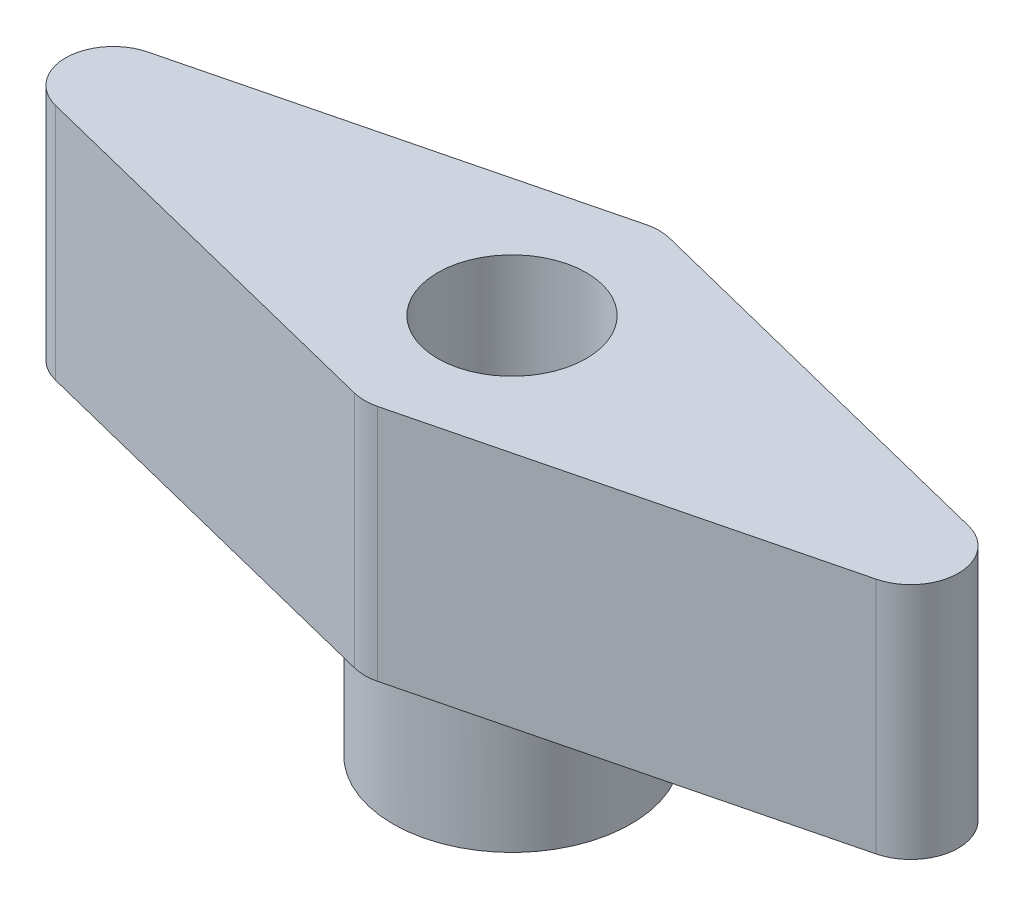
from build123d import *

# Parameters (mm, degrees)
BOSS_EXTRUDE1_DEPTH = 12.7
SHELL1_START        = -12.7
SHELL1_DEPTH        = 10.16
FILLET1_R           = 0.508
SKETCH2_R           = 6.35
SKETCH2_R_2         = 3.96875
BOSS_EXTRUDE2_DEPTH = 20.32
SKETCH3_R           = 3.96875
CUT_EXTRUDE1_DEPTH  = 31.743483417


# Read off the part's stored shape, not the designer's step: Shell1
with BuildPart() as part:
    # Sketch1 → Boss-Extrude1 (new body)
    with BuildSketch(Plane(origin=(0, 0, 0), x_dir=(1, 0, 0), z_dir=(0, 1, 0))):
        with BuildLine():
            Line((-21.893352199, -2.46416195), (-0.616040488, -7.783489878))
            ThreePointArc((-0.616040488, -7.783489878), (0, -7.859327928), (0.616040488, -7.783489878))
            Line((0.616040488, -7.783489878), (21.893352199, -2.46416195))
            ThreePointArc((21.893352199, -2.46416195), (23.817311711, 0), (21.893352199, 2.46416195))
            Line((21.893352199, 2.46416195), (0.616040488, 7.783489878))
            ThreePointArc((0.616040488, 7.783489878), (0, 7.859327928), (-0.616040488, 7.783489878))
            Line((-0.616040488, 7.783489878), (-21.893352199, 2.46416195))
            ThreePointArc((-21.893352199, 2.46416195), (-23.817311711, 0), (-21.893352199, -2.46416195))
        make_face()
    extrude(amount=-BOSS_EXTRUDE1_DEPTH)

    # Shell1 outline → Shell1 (cut)
    with BuildSketch(Plane(origin=(0, 0, 0), x_dir=(1, 0, 0), z_dir=(0, 1, 0)).offset(SHELL1_START)):
        Polygon((-21.277311711, 0), (0, -5.319327928), (21.277311711, 0), (0, 5.319327928), align=None)
    extrude(amount=SHELL1_DEPTH, mode=Mode.SUBTRACT)

    # Fillet1
    fillet1_edges = [part.edges().sort_by_distance(p)[0] for p in [
        (21.277311711, -7.62, 0),
        (0, -7.62, 5.319327928),
        (-21.277311711, -7.62, 0),
        (0, -7.62, -5.319327928),
    ]]
    fillet(fillet1_edges, radius=FILLET1_R)

    # Sketch2 → Boss-Extrude2 (add)
    with BuildSketch(Plane(origin=(0, 0, 0), x_dir=(1, 0, 0), z_dir=(0, 1, 0))):
        with Locations(Location((0, 0, 0), (0, 0, 270))):
            Circle(SKETCH2_R)
        with Locations(Location((0, 0, 0), (0, 0, 270))):
            Circle(SKETCH2_R_2, mode=Mode.SUBTRACT)
    extrude(amount=-BOSS_EXTRUDE2_DEPTH)

    # Sketch3 → Cut-Extrude1 (cut, through all)
    with BuildSketch(Plane.XZ.offset(2.54)):
        with Locations(Location((0, 0, 0), (0, 0, 90))):
            Circle(SKETCH3_R)
    extrude(amount=-CUT_EXTRUDE1_DEPTH, mode=Mode.SUBTRACT)


solid = part.part
